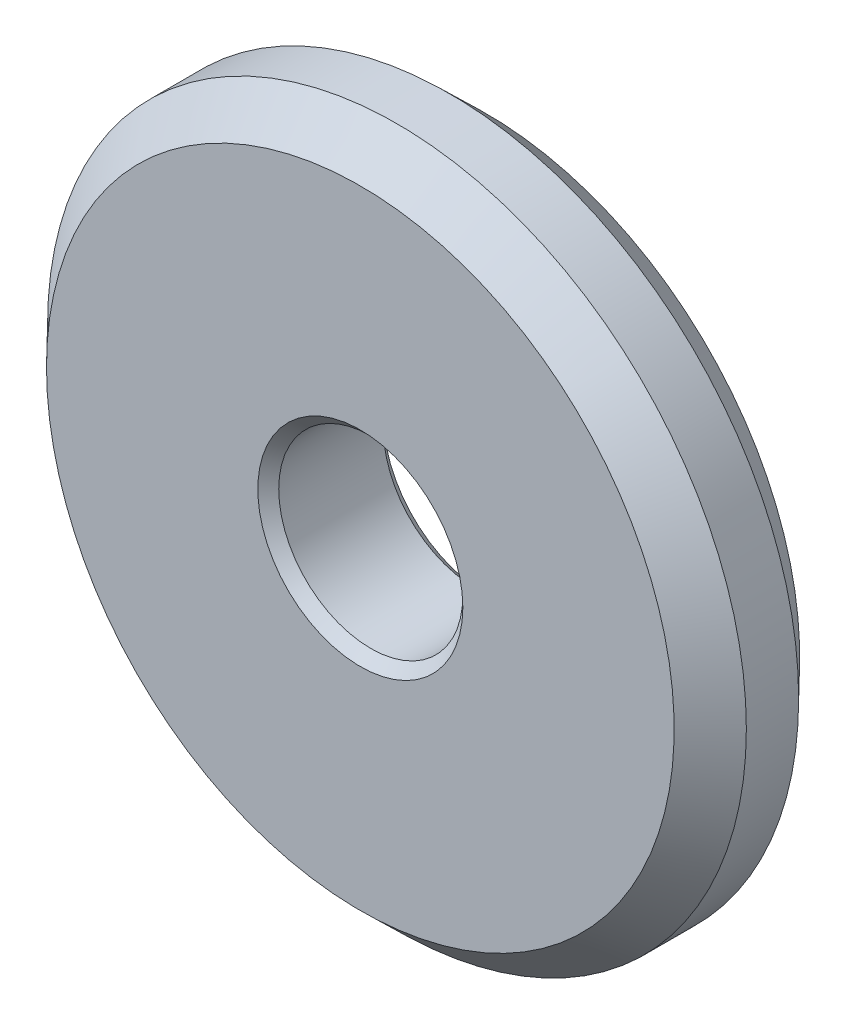
from build123d import *

# Parameters (mm, degrees)
CHAMFER1_SIZE = 0.5


with BuildPart() as part:
    # Sketch1 → Revolve1 (revolve)
    with BuildSketch(Plane(origin=(0, 0, 0), x_dir=(0, 0, -1), z_dir=(1, 0, 0))):
        Polygon((0, 4.4), (0, 15), (-1.75, 16.7), (-4.25, 16.7), (-6, 15), (-6, 4.4), align=None)
    revolve(axis=Axis((0, 0, 0), (0, 0, 1)))

    # Chamfer1
    chamfer1_edges = [part.edges().sort_by_distance(p)[0] for p in [
        (0, -4.4, 6),
        (0, -4.4, 0),
    ]]
    chamfer(chamfer1_edges, length=CHAMFER1_SIZE)


solid = part.part
